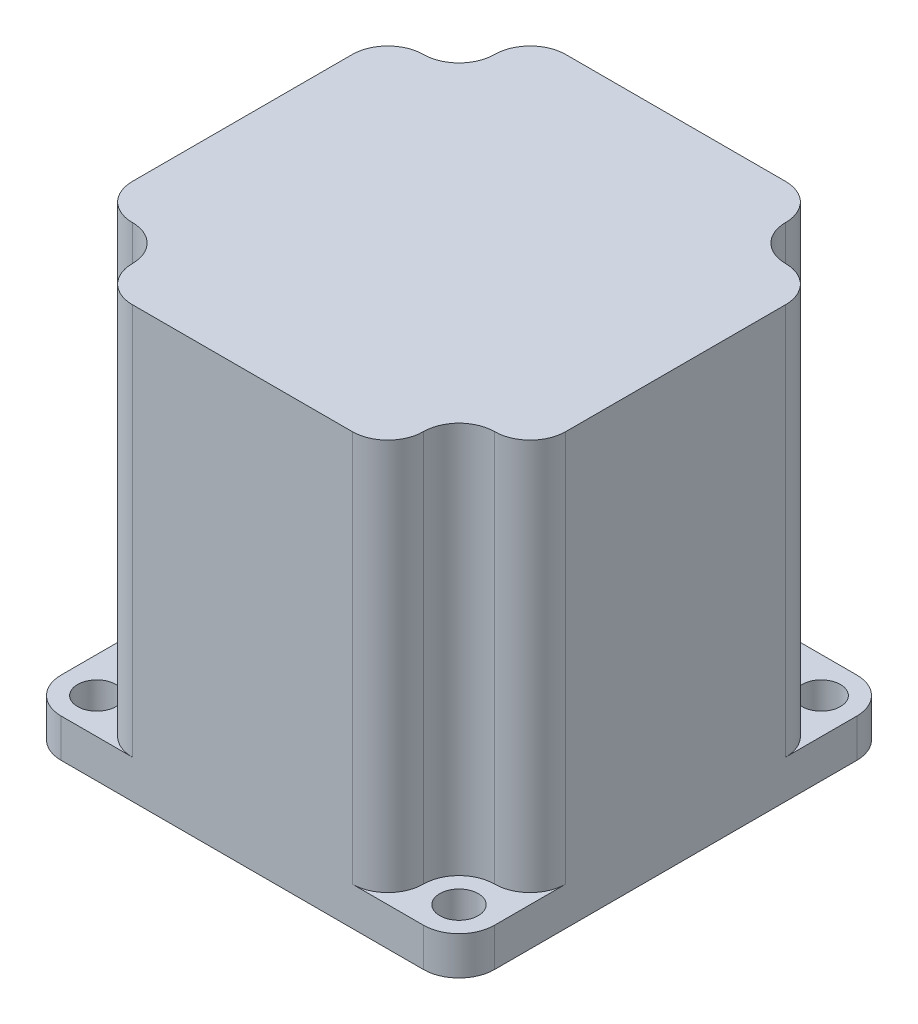
from build123d import *

# Parameters (mm, degrees)
SKETCH1_W                = 56.4
SKETCH1_H                = 56.4
BOSS_EXTRUDE1_DEPTH      = 56
SKETCH2_R                = 19.05
BOSS_EXTRUDE2_DEPTH      = 1.6
SKETCH3_R                = 3.175
BOSS_EXTRUDE3_DEPTH      = 19.4
CUT_EXTRUDE1_START       = -16
CUT_EXTRUDE1_DEPTH       = 16
F_5_0_5_DIAMETER_HOLE1_D = 5
SKETCH8_W                = 9.26
SKETCH8_H                = 9.26
CUT_EXTRUDE2_DEPTH       = 51
FILLET1_R                = 4.63


with BuildPart() as part:
    # Sketch1 → Boss-Extrude1 (new body)
    with BuildSketch(Plane(origin=(0, 0, 0), x_dir=(1, 0, 0), z_dir=(0, 1, 0))):
        Rectangle(SKETCH1_W, SKETCH1_H)
    extrude(amount=BOSS_EXTRUDE1_DEPTH)

    # Sketch2 → Boss-Extrude2 (add)
    with BuildSketch(Plane(origin=(0, 0, 0), x_dir=(1, 0, 0), z_dir=(0, 1, 0))):
        with Locations(Location((0, 0, 0), (0, 0, 270))):
            Circle(SKETCH2_R)
    extrude(amount=-BOSS_EXTRUDE2_DEPTH)

    # Sketch3 → Boss-Extrude3 (add)
    with BuildSketch(Plane.XZ.offset(1.6)):
        with Locations(Location((0, 0, 0), (0, 0, 90))):
            Circle(SKETCH3_R)
    extrude(amount=BOSS_EXTRUDE3_DEPTH)

    # Sketch4 → Cut-Extrude1 (cut)
    with BuildSketch(Plane.XZ.offset(21).offset(CUT_EXTRUDE1_START)):
        with BuildLine():
            Line((-1.78605711, 2.625), (1.78605711, 2.625))
            ThreePointArc((1.78605711, 2.625), (0, 3.175), (-1.78605711, 2.625))
        make_face()
    extrude(amount=CUT_EXTRUDE1_DEPTH, mode=Mode.SUBTRACT)

    # Ø5.0 (5) Diameter Hole1 (through all)
    with Locations(Plane(origin=(0, 0, 0), x_dir=(-1, 0, 0), z_dir=(0, -1, 0))):
        with Locations((-23.57, 23.569999995), (23.57, 23.57), (23.570000005, -23.57), (-23.569999995, -23.570000005)):
            Hole(F_5_0_5_DIAMETER_HOLE1_D / 2)

    # Sketch8 → Cut-Extrude2 (cut)
    with BuildSketch(Plane(origin=(0, 56, 0), x_dir=(1, 0, 0), z_dir=(0, 1, 0))):
        with Locations((-23.57, 23.57)):
            Rectangle(SKETCH8_W, SKETCH8_H)
        with Locations((23.57, 23.57)):
            Rectangle(SKETCH8_W, SKETCH8_H)
        with Locations((23.57, -23.57)):
            Rectangle(SKETCH8_W, SKETCH8_H)
        with Locations((-23.57, -23.57)):
            Rectangle(SKETCH8_W, SKETCH8_H)
    extrude(amount=-CUT_EXTRUDE2_DEPTH, mode=Mode.SUBTRACT)

    # Fillet1
    fillet1_edges = [part.edges().sort_by_distance(p)[0] for p in [
        (28.2, 2.5, 28.2),
        (28.2, 2.5, -28.2),
        (18.94, 30.5, -28.2),
        (28.2, 30.5, -18.94),
        (18.94, 30.5, -18.94),
        (18.94, 30.5, 18.94),
        (18.94, 30.5, 28.2),
        (28.2, 30.5, 18.94),
        (-18.94, 30.5, 18.94),
        (-18.94, 30.5, 28.2),
        (-28.2, 2.5, 28.2),
        (-28.2, 30.5, 18.94),
        (-18.94, 30.5, -28.2),
        (-28.2, 30.5, -18.94),
        (-28.2, 2.5, -28.2),
        (-18.94, 30.5, -18.94),
    ]]
    fillet(fillet1_edges, radius=FILLET1_R - 0.0001)  # a hair under: the kernel refuses the full size


solid = part.part
